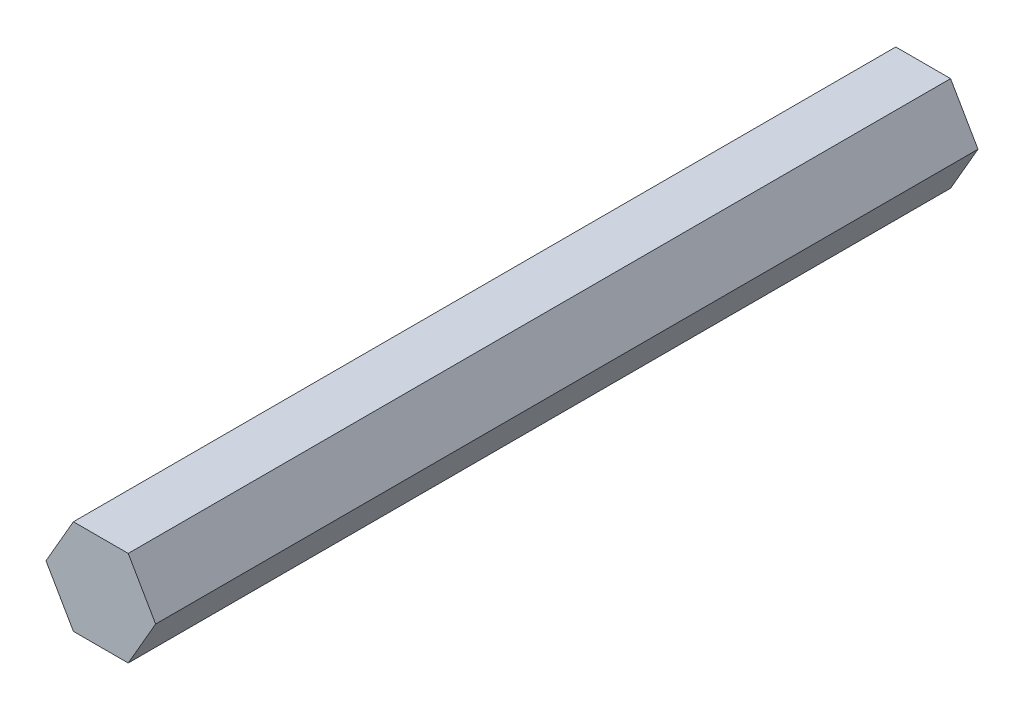
from build123d import *

# Parameters (mm, degrees)
BOSS_EXTRUDE1_DEPTH = 110


with BuildPart() as part:
    # Sketch1 → Boss-Extrude1 (new body)
    with BuildSketch(Plane.XY):
        Polygon((7.332348419, 0), (3.666174209, 6.35), (-3.666174209, 6.35), (-7.332348419, 0), (-3.666174209, -6.35), (3.666174209, -6.35), align=None)
    extrude(amount=BOSS_EXTRUDE1_DEPTH)


solid = part.part
